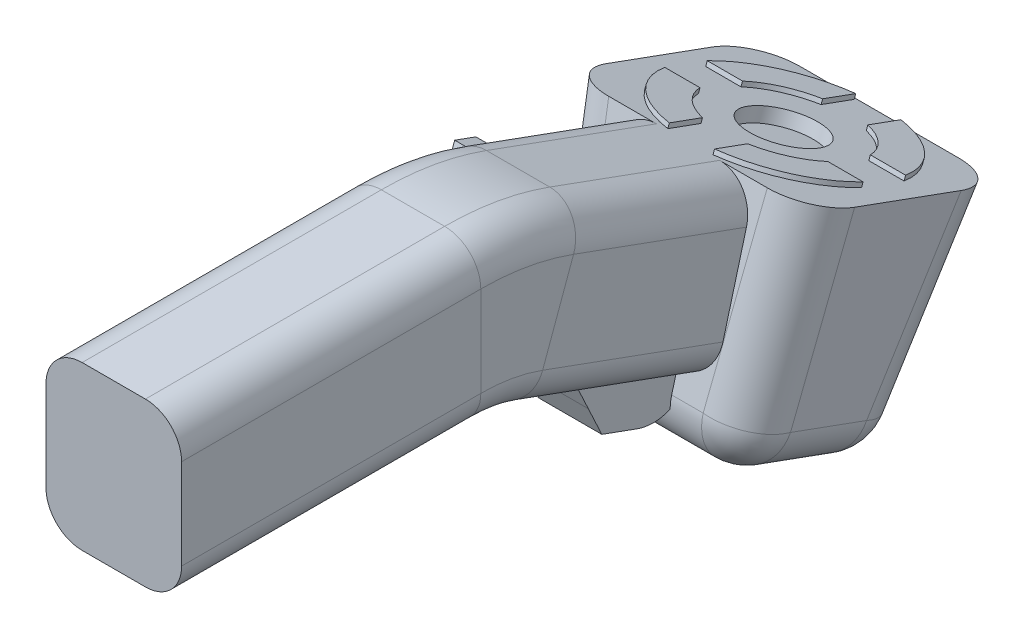
from build123d import *

# Parameters (mm, degrees)
SKETCH3_W           = 14
SKETCH3_H           = 28
BOSS_EXTRUDE1_DEPTH = 10
CHAMFER1_SIZE       = 5
SKETCH4_W           = 14
SKETCH4_H           = 10
CUT_EXTRUDE1_DEPTH  = 5
FILLET1_R           = 10
FILLET2_R           = 10
SKETCH5_W           = 55
SKETCH5_H           = 45
BOSS_EXTRUDE2_DEPTH = 50
BOSS_EXTRUDE2_DRAFT = -5
BOSS_EXTRUDE3_DEPTH = 10
CHAMFER2_SIZE       = 10
SKETCH7_R           = 8
CUT_EXTRUDE2_DEPTH  = 3
BOSS_EXTRUDE4_DEPTH = 1
FILLET3_R           = 10


# Some blends are built 0.0001 mm under size
with BuildPart() as part:
    # Sweep1: sweep along a path in Sketch2
    with BuildLine(Plane(origin=(0, 0, 0), x_dir=(0, 0, -1), z_dir=(1, 0, 0))) as sweep1_path:
        Line((0, 0), (66.183650965, 0))
        ThreePointArc((66.183650965, 0), (74.866059848, -0.759612349), (83.284658131, -3.015368961))
        Line((83.284658131, -3.015368961), (136.080020351, -22.231309316))
    # Sketch1 → Sweep1 (sweep)
    with BuildSketch(Plane.XY):
        with BuildLine():
            Line((7, -18), (-7, -18))
            ThreePointArc((-7, -18), (-12.656854249, -15.656854249), (-15, -10))
            Line((-15, -10), (-15, 10))
            ThreePointArc((-15, 10), (-12.656854249, 15.656854249), (-7, 18))
            Line((-7, 18), (7, 18))
            ThreePointArc((7, 18), (12.656854249, 15.656854249), (15, 10))
            Line((15, 10), (15, -10))
            ThreePointArc((15, -10), (12.656854249, -15.656854249), (7, -18))
        make_face()
    sweep(path=sweep1_path.line)

    # Sketch3 → Boss-Extrude1 (add)
    with BuildSketch(Plane(origin=(0, 7.190068189, -2.616970803), x_dir=(1, 0, 0), z_dir=(0, -0.939692620785908, 0.3420201433256697))):
        with Locations((0, -117.293295594)):
            Rectangle(SKETCH3_W, SKETCH3_H)
    extrude(amount=BOSS_EXTRUDE1_DEPTH)

    # Chamfer1
    chamfer1_edges = [part.edges().sort_by_distance(p)[0] for p in [
        (0, -28.138319575, -99.68091845),
    ]]
    chamfer(chamfer1_edges, length=CHAMFER1_SIZE)
    chamfer1_2_edges = [part.edges().sort_by_distance(p)[0] for p in [
        (0, -37.535245783, -96.260717017),
    ]]
    chamfer(chamfer1_2_edges, length=CHAMFER1_SIZE - 0.0001)  # a hair under: the kernel refuses the full size

    # Sketch4 → Cut-Extrude1 (cut)
    with BuildSketch(Plane(origin=(0, -2.206858019, 0.80323063), x_dir=(1, 0, 0), z_dir=(0, -0.9396926207859079, 0.34202014332567005))):
        with Locations((0, -126.293295594)):
            Rectangle(SKETCH4_W, SKETCH4_H)
    extrude(amount=-CUT_EXTRUDE1_DEPTH, mode=Mode.SUBTRACT)

    # Fillet1
    # the kernel refuses this fillet: 10 mm, written as the material it adds along each edge
    with BuildSketch(Plane(origin=(-7, -38.993145258, -114.885284907), x_dir=(0, -0.9396926207859382, 0.34202014332558694), z_dir=(1, 0, 0))) as fillet1_piece_1:
        with BuildLine():
            CenterArc((10, 8.660254038), FILLET1_R, 180, 60)
            Line((0, 8.660254038), (-0.2, 8.660254038))
            Line((-0.2, 8.660254038), (-0.2, 0))
            Line((-0.2, 0), (0, -0.2))
            ThreePointArc((0, -0.2), (2.5, -0.2), (4.9, -0.173205081))
            Line((4.9, -0.173205081), (5, 0))
        make_face()
    extrude(amount=14)

    # Fillet2
    fillet2_edges = [part.edges().sort_by_distance(p)[0] for p in [
        (0, -43.691608362, -113.175184191),
    ]]
    fillet(fillet2_edges, radius=FILLET2_R)


with BuildPart() as boss_extrude2_tool:
    # Sketch5 → Boss-Extrude2 (with draft: the straight prism first)
    with BuildSketch(Plane(origin=(0, 41.019002537, -14.929695963), x_dir=(1, 0, 0), z_dir=(0, 0.939692620785908, -0.34202014332566977))):
        with Locations((0, 141.793295594)):
            Rectangle(SKETCH5_W, SKETCH5_H)
    extrude(amount=-BOSS_EXTRUDE2_DEPTH)
    # Boss-Extrude2: the draft: its side faces are tilted about the plane it starts from
    boss_extrude2_sides = [boss_extrude2_tool.faces().sort_by_distance(p)[0] for p in [
        (0, -38.664929489, -160.764389894),
        (-27.5, -30.969476264, -139.621305927),
        (0, -23.274023039, -118.478221959),
        (27.5, -30.969476264, -139.621305927),
    ]]
    draft(boss_extrude2_sides, Plane(origin=(0, 41.019002537, -14.929695963), x_dir=(1, 0, 0), z_dir=(0, 0.939692620785908, -0.34202014332566977)), BOSS_EXTRUDE2_DRAFT)


with BuildPart() as part_1:
    add(part.part)

    # Boss-Extrude2: add boss_extrude2_tool
    add(boss_extrude2_tool.part)

    # Sketch6 → Boss-Extrude3 (add)
    with BuildSketch(Plane.ZY.offset(15)):
        Polygon((-107.658933731, -22.528657486), (-93.563544419, -17.398355336), (-100.403947286, 1.39549708), (-114.499336598, -3.73480507), align=None)
    extrude(amount=BOSS_EXTRUDE3_DEPTH)

    # Chamfer2
    chamfer2_edges = [part_1.edges().sort_by_distance(p)[0] for p in [
        (-20, -3.73480507, -114.499336598),
    ]]
    chamfer(chamfer2_edges, length=CHAMFER2_SIZE)

    # Sketch7 → Cut-Extrude2 (cut)
    with BuildSketch(Plane(origin=(0, 41.019002537, -14.929695963), x_dir=(1, 0, 0), z_dir=(0, 0.9396926207859081, -0.3420201433256698))):
        with Locations(Location((0, 141.793295594, 0), (0, 0, 270))):
            Circle(SKETCH7_R)
    extrude(amount=-CUT_EXTRUDE2_DEPTH, mode=Mode.SUBTRACT)

    # Sketch10 → Boss-Extrude4 (add)
    with BuildSketch(Plane(origin=(0, 41.019002537, -14.929695963), x_dir=(1, 0, 0), z_dir=(0, 0.9396926207859081, -0.3420201433256698))):
        with BuildLine():
            Line((14.142135624, 136.793295594), (21.937410968, 136.793295594))
            ThreePointArc((21.937410968, 136.793295594), (15.909902577, 125.883393018), (5, 119.855884626))
            Line((5, 119.855884626), (5, 127.651159971))
            ThreePointArc((5, 127.651159971), (10.606601718, 131.186693877), (14.142135624, 136.793295594))
        make_face()
        with BuildLine():
            Line((-5, 119.855884626), (-5, 127.651159971))
            ThreePointArc((-5, 127.651159971), (-10.606601718, 131.186693877), (-14.142135624, 136.793295594))
            Line((-14.142135624, 136.793295594), (-21.937410968, 136.793295594))
            ThreePointArc((-21.937410968, 136.793295594), (-15.909902577, 125.883393018), (-5, 119.855884626))
        make_face()
        with BuildLine():
            Line((-21.937410968, 146.793295594), (-14.142135624, 146.793295594))
            ThreePointArc((-14.142135624, 146.793295594), (-10.606601718, 152.399897312), (-5, 155.935431218))
            Line((-5, 155.935431218), (-5, 163.730706563))
            ThreePointArc((-5, 163.730706563), (-15.909902577, 157.703198171), (-21.937410968, 146.793295594))
        make_face()
        with BuildLine():
            Line((14.142135624, 146.793295594), (21.937410968, 146.793295594))
            ThreePointArc((21.937410968, 146.793295594), (15.909902577, 157.703198171), (5, 163.730706563))
            Line((5, 163.730706563), (5, 155.935431218))
            ThreePointArc((5, 155.935431218), (10.606601718, 152.399897312), (14.142135624, 146.793295594))
        make_face()
    extrude(amount=BOSS_EXTRUDE4_DEPTH)

    # Fillet3
    # the kernel refuses this fillet: 10 mm, written as the material it takes off along each edge
    with BuildSketch(Plane(origin=(13.962255084, -48.130137344, -142.912768744), x_dir=(-0.05900350758284425, -0.38201671186492897, 0.9222699268374899), z_dir=(0.5431604763459367, -0.7874344840965063, -0.2914165921688819))) as fillet3_piece_1_section:
        Polygon((-19.642374915, -19.642374915), (19.642374915, -19.642374915), (19.642374915, 19.642374915), (-19.642374915, 19.642374915), align=None)
    fillet3_piece_1 = extrude(amount=19.642374915, mode=Mode.PRIVATE)
    fillet3_piece_1 = split(fillet3_piece_1, bisect_by=Plane(origin=(13.962255084, -48.130137344, -142.912768744), z_dir=(-0.0868265938642479, -0.9028850613880008, 0.42102221855897237)), keep=Keep.TOP, mode=Mode.PRIVATE)
    fillet3_piece_1 = split(fillet3_piece_1, bisect_by=Plane(origin=(13.962255084, -48.130137344, -142.912768744), z_dir=(1, 0, 0)), keep=Keep.TOP, mode=Mode.PRIVATE)
    fillet3_piece_1 = split(fillet3_piece_1, bisect_by=Plane(origin=(13.962255084, -48.130137344, -142.912768744), z_dir=(0, -0.34202014332566977, -0.939692620785908)), keep=Keep.TOP, mode=Mode.PRIVATE)
    fillet3_piece_1 = split(fillet3_piece_1, bisect_by=Plane(origin=(23.924202064, -48.949133427, -142.614678548), z_dir=(-0.9961946980917455, 0.08189960831908964, -0.02980901962620929)), keep=Keep.TOP, mode=Mode.PRIVATE)
    fillet3_piece_1 = split(fillet3_piece_1, bisect_by=Plane(origin=(13.962255084, -52.356319961, -151.975846615), z_dir=(0, 0.4226182617407007, 0.9063077870366494)), keep=Keep.TOP, mode=Mode.PRIVATE)
    fillet3_piece_1 = split(fillet3_piece_1, bisect_by=Plane(origin=(13.962255084, -57.527063552, -139.492567311), z_dir=(0, 0.939692620785908, -0.34202014332566977)), keep=Keep.TOP, mode=Mode.PRIVATE)
    fillet3_piece_1 = fillet3_piece_1 - Plane(origin=(13.962255084, -48.130137344, -142.912768744), x_dir=(-0.5431604763459367, 0.7874344840965063, 0.2914165921688819), z_dir=(-0.05900350758284425, -0.38201671186492897, 0.9222699268374899)) * Sphere(FILLET3_R, mode=Mode.PRIVATE)
    add(fillet3_piece_1, mode=Mode.SUBTRACT)
    with BuildSketch(Plane(origin=(-13.962255084, -48.130137344, -142.912768744), x_dir=(0.7359928340771044, -0.6135606983424445, 0.28610805238001186), z_dir=(-0.5431604763459367, -0.7874344840965063, -0.2914165921688819))) as fillet3_piece_2_section:
        Polygon((-19.642374915, -19.642374915), (19.642374915, -19.642374915), (19.642374915, 19.642374915), (-19.642374915, 19.642374915), align=None)
    fillet3_piece_2 = extrude(amount=19.642374915, mode=Mode.PRIVATE)
    fillet3_piece_2 = split(fillet3_piece_2, bisect_by=Plane(origin=(-13.962255084, -48.130137344, -142.912768744), z_dir=(-1, 0, 0)), keep=Keep.TOP, mode=Mode.PRIVATE)
    fillet3_piece_2 = split(fillet3_piece_2, bisect_by=Plane(origin=(-13.962255084, -48.130137344, -142.912768744), z_dir=(0, -0.34202014332566977, -0.939692620785908)), keep=Keep.TOP, mode=Mode.PRIVATE)
    fillet3_piece_2 = split(fillet3_piece_2, bisect_by=Plane(origin=(-13.962255084, -48.130137344, -142.912768744), z_dir=(0.0868265938642479, -0.9028850613880008, 0.42102221855897237)), keep=Keep.TOP, mode=Mode.PRIVATE)
    fillet3_piece_2 = split(fillet3_piece_2, bisect_by=Plane(origin=(-13.962255084, -52.356319961, -151.975846615), z_dir=(0, 0.4226182617407007, 0.9063077870366494)), keep=Keep.TOP, mode=Mode.PRIVATE)
    fillet3_piece_2 = split(fillet3_piece_2, bisect_by=Plane(origin=(-13.962255084, -57.527063552, -139.492567311), z_dir=(0, 0.939692620785908, -0.34202014332566977)), keep=Keep.TOP, mode=Mode.PRIVATE)
    fillet3_piece_2 = split(fillet3_piece_2, bisect_by=Plane(origin=(-23.924202064, -48.949133427, -142.614678548), z_dir=(0.9961946980917455, 0.08189960831908964, -0.02980901962620929)), keep=Keep.TOP, mode=Mode.PRIVATE)
    fillet3_piece_2 = fillet3_piece_2 - Plane(origin=(-13.962255084, -48.130137344, -142.912768744), x_dir=(0.5431604763459367, 0.7874344840965063, 0.2914165921688819), z_dir=(0.7359928340771044, -0.6135606983424445, 0.28610805238001186)) * Sphere(FILLET3_R, mode=Mode.PRIVATE)
    add(fillet3_piece_2, mode=Mode.SUBTRACT)
    with BuildSketch(Plane(origin=(-13.962255084, -41.999593808, -126.069238809), x_dir=(0.7071067811865476, 0.241844762647976, 0.6644630243886744), z_dir=(-0.5431604763459366, -0.4158908361591537, 0.7293911908807889))) as fillet3_piece_3_section:
        Polygon((-19.642374915, -19.642374915), (19.642374915, -19.642374915), (19.642374915, 19.642374915), (-19.642374915, 19.642374915), align=None)
    fillet3_piece_3 = extrude(amount=19.642374915, mode=Mode.PRIVATE)
    fillet3_piece_3 = split(fillet3_piece_3, bisect_by=Plane(origin=(-13.962255084, -41.999593808, -126.069238809), z_dir=(0, 0.34202014332566977, 0.939692620785908)), keep=Keep.TOP, mode=Mode.PRIVATE)
    fillet3_piece_3 = split(fillet3_piece_3, bisect_by=Plane(origin=(-13.962255084, -41.999593808, -126.069238809), z_dir=(0.08682659386424792, -0.9622779495438604, 0.2578415994745548)), keep=Keep.TOP, mode=Mode.PRIVATE)
    fillet3_piece_3 = split(fillet3_piece_3, bisect_by=Plane(origin=(-13.962255084, -41.999593808, -126.069238809), z_dir=(-1, 0, 0)), keep=Keep.TOP, mode=Mode.PRIVATE)
    fillet3_piece_3 = split(fillet3_piece_3, bisect_by=Plane(origin=(-13.962255084, -51.396520016, -122.649037376), z_dir=(0, 0.939692620785908, -0.34202014332566977)), keep=Keep.TOP, mode=Mode.PRIVATE)
    fillet3_piece_3 = split(fillet3_piece_3, bisect_by=Plane(origin=(-23.924202064, -42.818589891, -125.771148613), z_dir=(0.9961946980917455, 0.08189960831908964, -0.02980901962620929)), keep=Keep.TOP, mode=Mode.PRIVATE)
    fillet3_piece_3 = split(fillet3_piece_3, bisect_by=Plane(origin=(-13.962255084, -39.411403357, -116.409980546), z_dir=(0, -0.2588190451025215, -0.9659258262890682)), keep=Keep.TOP, mode=Mode.PRIVATE)
    fillet3_piece_3 = fillet3_piece_3 - Plane(origin=(-13.962255084, -41.999593808, -126.069238809), x_dir=(0.5431604763459366, 0.4158908361591537, -0.7293911908807889), z_dir=(0.7071067811865476, 0.241844762647976, 0.6644630243886744)) * Sphere(FILLET3_R, mode=Mode.PRIVATE)
    add(fillet3_piece_3, mode=Mode.SUBTRACT)
    with BuildSketch(Plane(origin=(13.962255084, -41.999593808, -126.069238809), x_dir=(0.05900350758284439, 0.8854654610603633, 0.46094414342963447), z_dir=(0.5431604763459366, -0.4158908361591537, 0.7293911908807889))) as fillet3_piece_4_section:
        Polygon((-19.642374915, -19.642374915), (19.642374915, -19.642374915), (19.642374915, 19.642374915), (-19.642374915, 19.642374915), align=None)
    fillet3_piece_4 = extrude(amount=19.642374915, mode=Mode.PRIVATE)
    fillet3_piece_4 = split(fillet3_piece_4, bisect_by=Plane(origin=(13.962255084, -41.999593808, -126.069238809), z_dir=(0, 0.34202014332566977, 0.939692620785908)), keep=Keep.TOP, mode=Mode.PRIVATE)
    fillet3_piece_4 = split(fillet3_piece_4, bisect_by=Plane(origin=(13.962255084, -41.999593808, -126.069238809), z_dir=(1, 0, 0)), keep=Keep.TOP, mode=Mode.PRIVATE)
    fillet3_piece_4 = split(fillet3_piece_4, bisect_by=Plane(origin=(13.962255084, -41.999593808, -126.069238809), z_dir=(-0.08682659386424792, -0.9622779495438604, 0.2578415994745548)), keep=Keep.TOP, mode=Mode.PRIVATE)
    fillet3_piece_4 = split(fillet3_piece_4, bisect_by=Plane(origin=(23.924202064, -42.818589891, -125.771148613), z_dir=(-0.9961946980917455, 0.08189960831908964, -0.02980901962620929)), keep=Keep.TOP, mode=Mode.PRIVATE)
    fillet3_piece_4 = split(fillet3_piece_4, bisect_by=Plane(origin=(13.962255084, -51.396520016, -122.649037376), z_dir=(0, 0.939692620785908, -0.34202014332566977)), keep=Keep.TOP, mode=Mode.PRIVATE)
    fillet3_piece_4 = split(fillet3_piece_4, bisect_by=Plane(origin=(13.962255084, -39.411403357, -116.409980546), z_dir=(0, -0.2588190451025215, -0.9659258262890682)), keep=Keep.TOP, mode=Mode.PRIVATE)
    fillet3_piece_4 = fillet3_piece_4 - Plane(origin=(13.962255084, -41.999593808, -126.069238809), x_dir=(-0.5431604763459366, 0.4158908361591537, -0.7293911908807889), z_dir=(0.05900350758284439, 0.8854654610603633, 0.46094414342963447)) * Sphere(FILLET3_R, mode=Mode.PRIVATE)
    add(fillet3_piece_4, mode=Mode.SUBTRACT)
    with BuildSketch(Plane(origin=(13.962255084, -60.661100747, -148.103263735), x_dir=(0, 0.9063077870366486, -0.4226182617407022), z_dir=(-1, 0, 0))) as fillet3_piece_5:
        with BuildLine():
            CenterArc((FILLET3_R * 0.916331174017, -FILLET3_R), FILLET3_R, 90, 85)
            Line((-FILLET3_R * 0.0798635240743, -FILLET3_R * 0.912844257252), (0, 0))
            Line((0, 0), (FILLET3_R * 0.916331174017, 0))
        make_face()
    extrude(amount=27.924510167, mode=Mode.SUBTRACT)
    with BuildSketch(Plane(origin=(-23.125566824, -57.527063552, -139.492567311), x_dir=(-0.08715574274765854, 0.9361168066628587, -0.3407186534216111), z_dir=(0, 0.34202014332566977, 0.939692620785908)), Plane(origin=(23.125566824, -51.396520016, -122.649037376), x_dir=(0.08715574274765832, 0.9361168066628587, -0.3407186534216111), z_dir=(0, -0.34202014332566977, -0.939692620785908))) as fillet3_piece_6:
        with BuildLine():
            CenterArc((FILLET3_R * 0.916331174017, -FILLET3_R), FILLET3_R, 90, 85)
            Line((-FILLET3_R * 0.0798635240743, -FILLET3_R * 0.912844257252), (0, 0))
            Line((0, 0), (FILLET3_R * 0.916331174017, 0))
        make_face()
    extrude(amount=17.924510167, mode=Mode.SUBTRACT)
    with BuildSketch(Plane(origin=(-13.962255084, -48.262482821, -114.038340952), x_dir=(0, 0.9659258262890681, -0.2588190451025217), z_dir=(1, 0, 0))) as fillet3_piece_7_section:
        with BuildLine():
            CenterArc((FILLET3_R * 0.916331174017, -FILLET3_R), FILLET3_R, 90, 85)
            Line((-FILLET3_R * 0.0798635240743, -FILLET3_R * 0.912844257252), (0, 0))
            Line((0, 0), (FILLET3_R * 0.916331174017, 0))
        make_face()
    fillet3_piece_7 = extrude(amount=27.924510167, mode=Mode.PRIVATE)
    fillet3_piece_7 = split(fillet3_piece_7, bisect_by=Plane(origin=(-7, -48.262482821, -114.038340952), z_dir=(-1, 0, 0)), keep=Keep.TOP, mode=Mode.PRIVATE)
    fillet3_piece_7 = fillet3_piece_7 & Plane(origin=(-13.962255084, -32.732162269, -112.30239752), x_dir=(0, -0.9309945262431326, -0.36503313836599144), z_dir=(1, 0, 0)) * Cylinder(10, 93, mode=Mode.PRIVATE)
    add(fillet3_piece_7, mode=Mode.SUBTRACT)
    with BuildSketch(Plane(origin=(-13.962255084, -48.262482821, -114.038340952), x_dir=(0, 0.9659258262890681, -0.2588190451025217), z_dir=(1, 0, 0))) as fillet3_piece_8_section:
        with BuildLine():
            CenterArc((FILLET3_R * 0.916331174017, -FILLET3_R), FILLET3_R, 90, 85)
            Line((-FILLET3_R * 0.0798635240743, -FILLET3_R * 0.912844257252), (0, 0))
            Line((0, 0), (FILLET3_R * 0.916331174017, 0))
        make_face()
    fillet3_piece_8 = extrude(amount=27.924510167, mode=Mode.PRIVATE)
    fillet3_piece_8 = split(fillet3_piece_8, bisect_by=Plane(origin=(-7, -48.262482821, -114.038340952), z_dir=(-1, 0, 0)), keep=Keep.TOP, mode=Mode.PRIVATE)
    fillet3_piece_8 = fillet3_piece_8 - Plane(origin=(-13.962255084, -32.732162269, -112.30239752), x_dir=(0, -0.9309945262431326, -0.36503313836599144), z_dir=(1, 0, 0)) * Cylinder(10, 93, mode=Mode.PRIVATE)
    add(fillet3_piece_8, mode=Mode.SUBTRACT)
    with BuildSketch(Plane(origin=(-13.962255084, -48.262482821, -114.038340952), x_dir=(0, 0.9659258262890681, -0.2588190451025217), z_dir=(1, 0, 0))) as fillet3_piece_9_section:
        with BuildLine():
            CenterArc((FILLET3_R * 0.916331174017, -FILLET3_R), FILLET3_R, 90, 85)
            Line((-FILLET3_R * 0.0798635240743, -FILLET3_R * 0.912844257252), (0, 0))
            Line((0, 0), (FILLET3_R * 0.916331174017, 0))
        make_face()
    fillet3_piece_9 = extrude(amount=27.924510167, mode=Mode.PRIVATE)
    fillet3_piece_9 = split(fillet3_piece_9, bisect_by=Plane(origin=(-7, -48.262482821, -114.038340952), z_dir=(1, 0, 0)), keep=Keep.TOP, mode=Mode.PRIVATE)
    fillet3_piece_9 = fillet3_piece_9 - Plane(origin=(-13.962255084, -32.732162269, -112.30239752), x_dir=(0, -0.9309945262431326, -0.36503313836599144), z_dir=(1, 0, 0)) * Cylinder(10, 93, mode=Mode.PRIVATE)
    fillet3_piece_9 = split(fillet3_piece_9, bisect_by=Plane(origin=(7, -48.262482821, -114.038340952), z_dir=(-1, 0, 0)), keep=Keep.TOP, mode=Mode.PRIVATE)
    add(fillet3_piece_9, mode=Mode.SUBTRACT)
    with BuildSketch(Plane(origin=(-13.962255084, -48.262482821, -114.038340952), x_dir=(0, 0.9659258262890681, -0.2588190451025217), z_dir=(1, 0, 0))) as fillet3_piece_10_section:
        with BuildLine():
            CenterArc((FILLET3_R * 0.916331174017, -FILLET3_R), FILLET3_R, 90, 85)
            Line((-FILLET3_R * 0.0798635240743, -FILLET3_R * 0.912844257252), (0, 0))
            Line((0, 0), (FILLET3_R * 0.916331174017, 0))
        make_face()
    fillet3_piece_10 = extrude(amount=27.924510167, mode=Mode.PRIVATE)
    fillet3_piece_10 = fillet3_piece_10 & Plane(origin=(-13.962255084, -32.732162269, -112.30239752), x_dir=(0, -0.9309945262431326, -0.36503313836599144), z_dir=(1, 0, 0)) * Cylinder(10, 93, mode=Mode.PRIVATE)
    fillet3_piece_10 = split(fillet3_piece_10, bisect_by=Plane(origin=(7, -48.262482821, -114.038340952), z_dir=(1, 0, 0)), keep=Keep.TOP, mode=Mode.PRIVATE)
    add(fillet3_piece_10, mode=Mode.SUBTRACT)
    with BuildSketch(Plane(origin=(-13.962255084, -48.262482821, -114.038340952), x_dir=(0, 0.9659258262890681, -0.2588190451025217), z_dir=(1, 0, 0))) as fillet3_piece_11_section:
        with BuildLine():
            CenterArc((FILLET3_R * 0.916331174017, -FILLET3_R), FILLET3_R, 90, 85)
            Line((-FILLET3_R * 0.0798635240743, -FILLET3_R * 0.912844257252), (0, 0))
            Line((0, 0), (FILLET3_R * 0.916331174017, 0))
        make_face()
    fillet3_piece_11 = extrude(amount=27.924510167, mode=Mode.PRIVATE)
    fillet3_piece_11 = fillet3_piece_11 - Plane(origin=(-13.962255084, -32.732162269, -112.30239752), x_dir=(0, -0.9309945262431326, -0.36503313836599144), z_dir=(1, 0, 0)) * Cylinder(10, 93, mode=Mode.PRIVATE)
    fillet3_piece_11 = split(fillet3_piece_11, bisect_by=Plane(origin=(7, -48.262482821, -114.038340952), z_dir=(1, 0, 0)), keep=Keep.TOP, mode=Mode.PRIVATE)
    add(fillet3_piece_11, mode=Mode.SUBTRACT)
    with BuildSketch(Plane(origin=(29.65423836, 7.228698204, -179.760796897), x_dir=(0.007567436278487963, 0.4220083175478485, 0.906560375170129), z_dir=(-0.08682659386424792, -0.9028850613880008, 0.42102221855897237)), Plane(origin=(29.65423836, 24.093190479, -133.42598518), x_dir=(-0.9962234400966145, 0.08386804942218848, -0.022472376113451063), z_dir=(-0.08682659386424793, -0.9622779495438604, 0.2578415994745548)), Plane(origin=(-29.65423836, 7.228698204, -179.760796897), x_dir=(0.9962234400966147, 0.07869161814103695, -0.036694504171773175), z_dir=(0.08682659386424792, -0.9028850613880008, 0.42102221855897237))) as fillet3_piece_12:
        with BuildLine():
            CenterArc((FILLET3_R * 0.992432509139, FILLET3_R), FILLET3_R, 180.435230002, 89.564769998)
            Line((-FILLET3_R * 0.00753863989878, FILLET3_R * 0.992403876506), (0, 0))
            Line((0, 0), (FILLET3_R * 0.992432509139, 0))
        make_face()
    extrude(amount=66.858985653, mode=Mode.SUBTRACT)
    with BuildSketch(Plane(origin=(-29.65423836, 24.093190479, -133.42598518), x_dir=(0.9962234400966145, 0.08386804942218848, -0.022472376113451063), z_dir=(0.08682659386424793, -0.9622779495438604, 0.2578415994745548))) as fillet3_piece_13:
        with BuildLine():
            CenterArc((FILLET3_R * 0.992432509139, -FILLET3_R), FILLET3_R, 90, 89.564769998)
            Line((-FILLET3_R * 0.00753863989877, -FILLET3_R * 0.992403876506), (0, 0))
            Line((0, 0), (FILLET3_R * 0.992432509139, 0))
        make_face()
    extrude(amount=66.858985653, mode=Mode.SUBTRACT)


solid = part_1.part
